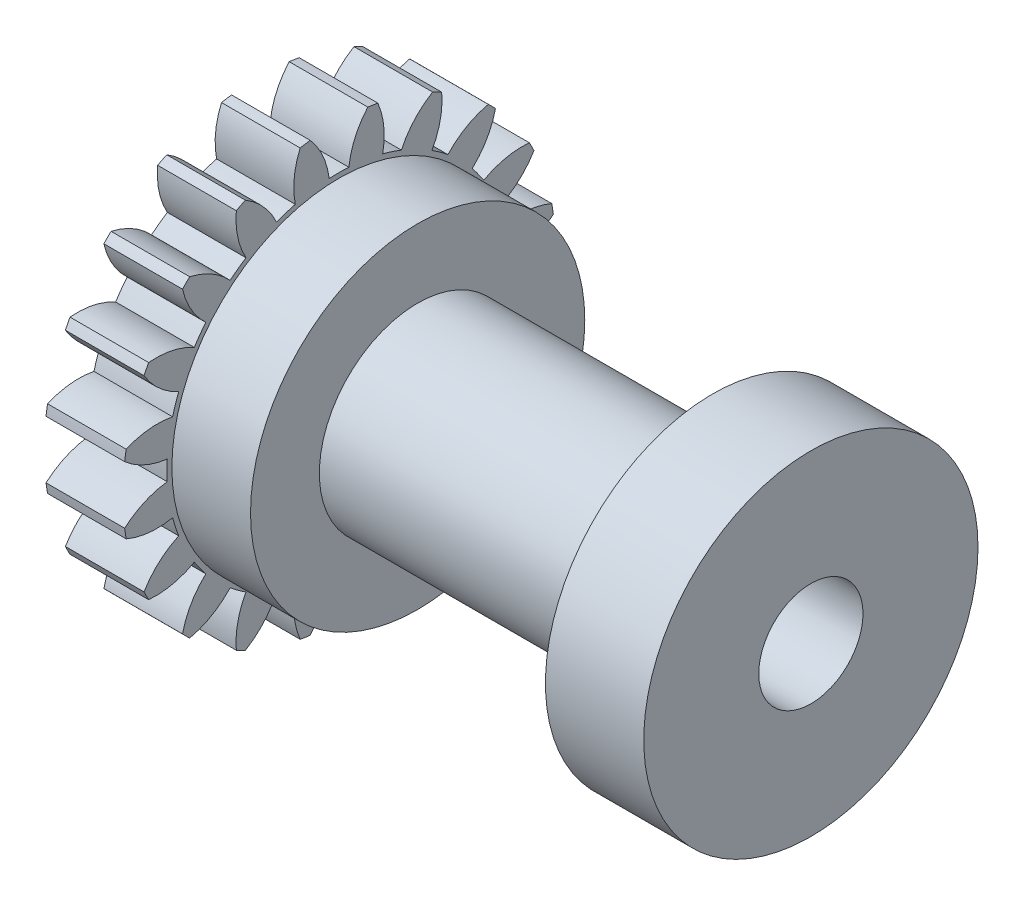
from build123d import *

# Parameters (mm, degrees)
BASPROSKE_W             = 4
BASPROSKE_H             = 11
TOOTHCUT_DEPTH          = 17.062378404
TEETHCUTS_COUNT         = 20
TEETHCUTS_ANGLE         = 342
BORSKE_R                = 2.5
BORE_DEPTH              = 50.0000508
SKETCH1_R               = 8.5
BOSS_EXTRUDE1_DEPTH     = 4
SKETCH2_R               = 5
BOSS_EXTRUDE2_DEPTH     = 15
SKETCH3_R               = 8.5
BOSS_EXTRUDE3_DEPTH     = 5
CUT_EXTRUDE1_DEPTH      = 32.964164392
CUT_EXTRUDE1_DEPTH_BACK = 32.964164392
SKETCH4_R               = 2.65


with BuildPart() as part:
    # BasProSke → Base-Revolve (revolve)
    with BuildSketch(Plane(origin=(0, 0, 0), x_dir=(1, 0, 0), z_dir=(0, 1, 0))):
        with Locations((2, 5.5)):
            Rectangle(BASPROSKE_W, BASPROSKE_H)
    revolve(axis=Axis((-10, 0, 0), (1, 0, 0)))

    # TooCutSke → ToothCut (cut, through all)
    with BuildSketch(Plane(origin=(0, 0, 0), x_dir=(0, 0, -1), z_dir=(1, 0, 0))):
        with BuildLine():
            ThreePointArc((0.499924007, 8.734705318), (0, 8.749), (-0.499924007, 8.734705318))
            ThreePointArc((-0.499924007, 8.734705318), (-0.824302243, 9.905497836), (-1.485192705, 10.924909509))
            ThreePointArc((-1.485192705, 10.924909509), (0, 11.0254), (1.485192705, 10.924909509))
            ThreePointArc((1.485192705, 10.924909509), (0.824302243, 9.905497836), (0.499924007, 8.734705318))
        make_face()
    toothcut = extrude(amount=TOOTHCUT_DEPTH, mode=Mode.SUBTRACT)

    # TeethCuts: ToothCut ×20 about axis
    teethcuts_axis = Axis((-10, 0, 0), (1, 0, 0))
    for i in range(1, TEETHCUTS_COUNT):
        add(toothcut.rotate(teethcuts_axis, i * TEETHCUTS_ANGLE / (TEETHCUTS_COUNT - 1)), mode=Mode.SUBTRACT)

    # BorSke → Bore (cut, symmetric)
    with BuildSketch(Plane(origin=(0, 0, 0), x_dir=(0, 0, -1), z_dir=(1, 0, 0))):
        Circle(BORSKE_R)
    extrude(amount=BORE_DEPTH, both=True, mode=Mode.SUBTRACT)

    # Sketch1 → Boss-Extrude1 (add)
    with BuildSketch(Plane(origin=(4, 0, 0), x_dir=(0, 0, -1), z_dir=(1, 0, 0))):
        Circle(SKETCH1_R)
    extrude(amount=BOSS_EXTRUDE1_DEPTH)

    # Sketch2 → Boss-Extrude2 (add)
    with BuildSketch(Plane(origin=(8, 0, 0), x_dir=(0, 0, -1), z_dir=(1, 0, 0))):
        Circle(SKETCH2_R)
    extrude(amount=BOSS_EXTRUDE2_DEPTH)

    # Sketch3 → Boss-Extrude3 (add)
    with BuildSketch(Plane(origin=(23, 0, 0), x_dir=(0, 0, -1), z_dir=(1, 0, 0))):
        Circle(SKETCH3_R)
    extrude(amount=BOSS_EXTRUDE3_DEPTH)

    # Sketch4 → Cut-Extrude1 (cut, two sides: drawn at the far end of the back side and taken through both)
    with BuildSketch(Plane(origin=(28, 0, 0), x_dir=(0, 0, -1), z_dir=(1, 0, 0)).offset(-CUT_EXTRUDE1_DEPTH_BACK)):
        Circle(SKETCH4_R)
    extrude(amount=CUT_EXTRUDE1_DEPTH + CUT_EXTRUDE1_DEPTH_BACK, mode=Mode.SUBTRACT)


solid = part.part
